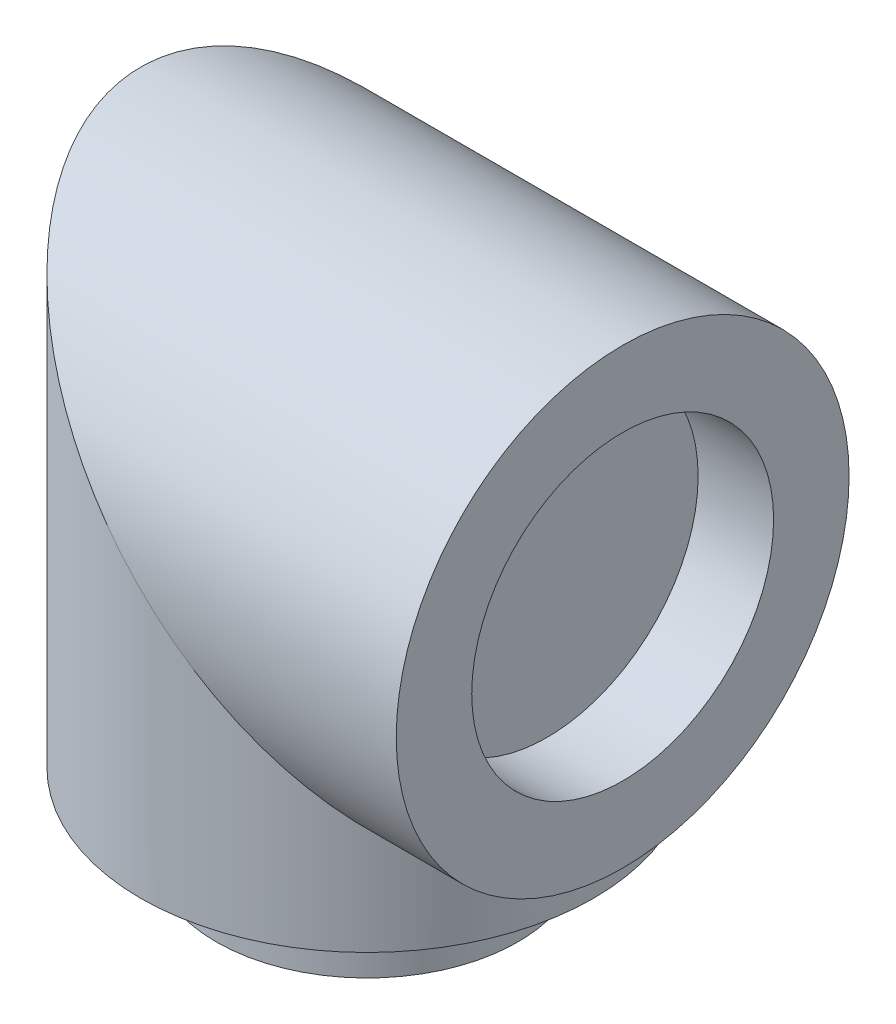
from build123d import *

# Parameters (mm, degrees)
SKETCH1_R           = 50.8
BOSS_EXTRUDE1_DEPTH = 25.4
SKETCH2_R           = 76.2
BOSS_EXTRUDE2_DEPTH = 89.9
SKETCH4_R           = 76.2
BOSS_EXTRUDE3_DEPTH = 86
CUT_EXTRUDE1_DEPTH  = 202.96942838
SKETCH7_R           = 50.8
CUT_EXTRUDE2_DEPTH  = 25.4


with BuildPart() as part:
    # Sketch1 → Boss-Extrude1 (new body)
    with BuildSketch(Plane(origin=(0, 0, 0), x_dir=(1, 0, 0), z_dir=(0, 1, 0))):
        Circle(SKETCH1_R)
    extrude(amount=BOSS_EXTRUDE1_DEPTH)

    # Sketch2 → Boss-Extrude2 (add)
    with BuildSketch(Plane(origin=(0, 25.4, 0), x_dir=(1, 0, 0), z_dir=(0, 1, 0))):
        Circle(SKETCH2_R)
    extrude(amount=BOSS_EXTRUDE2_DEPTH)

    # Sketch4 → Boss-Extrude3 (add, symmetric)
    with BuildSketch(Plane(origin=(0, 0, 0), x_dir=(0, 0, -1), z_dir=(1, 0, 0))):
        with Locations((0, 115.3)):
            Circle(SKETCH4_R)
    extrude(amount=BOSS_EXTRUDE3_DEPTH, both=True)

    # Sketch5 → Cut-Extrude1 (cut, through all)
    with BuildSketch(Plane.XZ.offset(-25.4)):
        with BuildLine():
            Line((0, 76.2), (0, 148.473309088))
            ThreePointArc((0, 148.473309088), (-148.473309088, 0), (0, -148.473309088))
            Line((0, -148.473309088), (0, -76.2))
            ThreePointArc((0, -76.2), (-76.2, 0), (0, 76.2))
        make_face()
    extrude(amount=-CUT_EXTRUDE1_DEPTH, mode=Mode.SUBTRACT)

    # Sketch7 → Cut-Extrude2 (cut)
    with BuildSketch(Plane(origin=(86, 0, 0), x_dir=(0, 0, -1), z_dir=(1, 0, 0))):
        with Locations((0, 115.3)):
            Circle(SKETCH7_R)
    extrude(amount=-CUT_EXTRUDE2_DEPTH, mode=Mode.SUBTRACT)


solid = part.part
